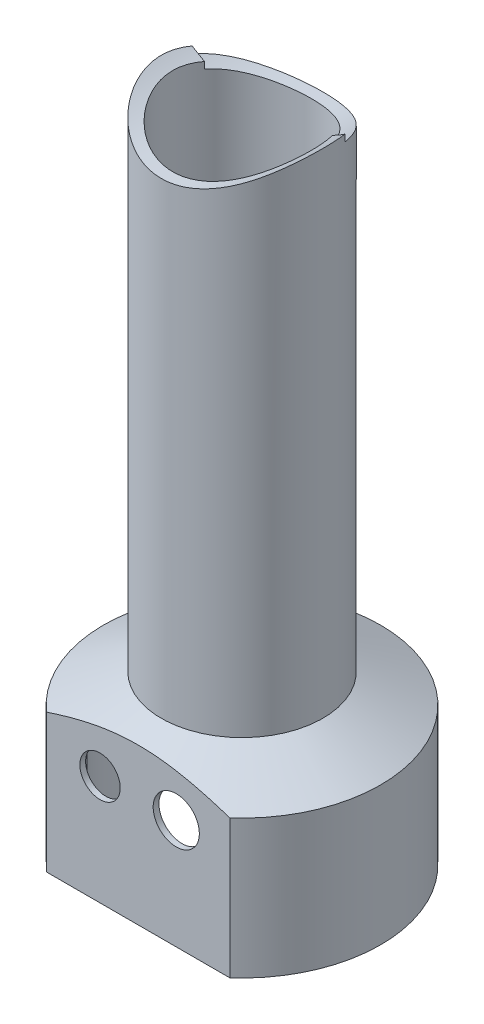
from build123d import *

# Parameters (mm, degrees)
SKETCH1_R               = 14
BOSS_EXTRUDE1_DEPTH     = 105
SKETCH2_R               = 24
CUT_EXTRUDE1_DEPTH      = 110.567330897
SKETCH4_R               = 25
CUT_EXTRUDE2_DEPTH      = 9.4
SKETCH5_R               = 12
CUT_EXTRUDE3_DEPTH      = 123
SKETCH10_R              = 14
SKETCH8_R               = 24
SKETCH12_R              = 24
SKETCH12_R_2            = 19
BOSS_EXTRUDE2_DEPTH     = 24
SKETCH13_R              = 1.6
CUT_EXTRUDE4_DEPTH      = 8
CUT_EXTRUDE6_DEPTH      = 6
BOSS_EXTRUDE7_DEPTH     = 1
CUT_EXTRUDE7_OUTLINE_W  = 25.205591592
CUT_EXTRUDE7_OUTLINE_H  = 24
CUT_EXTRUDE7_DEPTH      = 2.781366517
SKETCH20_R              = 4
SKETCH20_R_2            = 3.5
CUT_EXTRUDE8_DEPTH      = 10
SKETCH22_R              = 1.05
BOSS_EXTRUDE8_DEPTH     = 1
CUT_EXTRUDE9_DEPTH      = 10
CUT_EXTRUDE9_DEPTH_BACK = 5
SKETCH23_R              = 2


with BuildPart() as part:
    # Sketch1 → Boss-Extrude1 (new body)
    with BuildSketch(Plane(origin=(0, 0, 0), x_dir=(1, 0, 0), z_dir=(0, 1, 0))):
        with Locations(Location((0, 0, 0), (0, 0, 270))):
            Circle(SKETCH1_R)
    extrude(amount=BOSS_EXTRUDE1_DEPTH)

    # Sketch2 → Cut-Extrude1 (cut, through all)
    with BuildSketch(Plane(origin=(0, 0, -14), x_dir=(-1, 0, 0), z_dir=(0, 0, -1))):
        with Locations((0, 105)):
            Circle(SKETCH2_R)
    extrude(amount=-CUT_EXTRUDE1_DEPTH, mode=Mode.SUBTRACT)

    # Sketch4 → Cut-Extrude2 (cut)
    with BuildSketch(Plane(origin=(0, 0, -14), x_dir=(-1, 0, 0), z_dir=(0, 0, -1))):
        with Locations((0, 105)):
            Circle(SKETCH4_R)
    extrude(amount=-CUT_EXTRUDE2_DEPTH, mode=Mode.SUBTRACT)

    # Sketch5 → Cut-Extrude3 (cut)
    with BuildSketch(Plane.XZ):
        with Locations(Location((0, 0, 0), (0, 0, 270))):
            Circle(SKETCH5_R)
    extrude(amount=-CUT_EXTRUDE3_DEPTH, mode=Mode.SUBTRACT)

    # Sketch10 → Loft6 section 0
    with BuildSketch(Plane(origin=(0, 0, 0), x_dir=(-1, 0, 0), z_dir=(0, -1, 0))):
        Circle(SKETCH10_R)
    # Sketch8 → Loft6 section 1
    with BuildSketch(Plane(origin=(0, -5, 0), x_dir=(-1, 0, 0), z_dir=(0, -1, 0))):
        Circle(SKETCH8_R)
    loft()

    # Cut-Loft1: read off the stored shape, not the designer's step
    # Cut-Loft1: loft between two sections, ruled curve by curve
    cut_loft1_from = [
        Edge.make_bspline([(-6.918556866, 0, -9.804772863), (12.69098886, 0, -23.641886595), (26.528102592, 0, -4.032340869), (6.918556866, 0, 9.804772863), (-12.69098886, 0, 23.641886595), (-26.528102592, 0, 4.032340869), (-6.918556866, 0, -9.804772863)], [0, 0, 0, 0, 0.5, 0.5, 0.5, 1, 1, 1, 1], 3, [1, 0.333333333, 0.333333333, 1, 0.333333333, 0.333333333, 1]),
    ]
    cut_loft1_to = [
        Edge.make_bspline([(3.659825819, -5, -21.693447743), (47.046721305, -5, -14.373796105), (39.727069667, -5, 29.013099381), (-3.659825819, -5, 21.693447743), (-47.046721305, -5, 14.373796105), (-39.727069667, -5, -29.013099381), (3.659825819, -5, -21.693447743)], [0, 0, 0, 0, 0.5, 0.5, 0.5, 1, 1, 1, 1], 3, [1, 0.333333333, 0.333333333, 1, 0.333333333, 0.333333333, 1]),
    ]
    cut_loft1 = Solid(Shell([*[Face.make_surface_from_curves(cut_loft1_from[k], cut_loft1_to[k]) for k in range(1)], Face(Wire(cut_loft1_from)), Face(Wire(cut_loft1_to))]))
    add(cut_loft1, mode=Mode.SUBTRACT)

    # Sketch12 → Boss-Extrude2 (add)
    with BuildSketch(Plane.XZ.offset(5)):
        Circle(SKETCH12_R)
        Circle(SKETCH12_R_2, mode=Mode.SUBTRACT)
    extrude(amount=BOSS_EXTRUDE2_DEPTH)

    # Sketch13 → Cut-Extrude4 (cut)
    with BuildSketch(Plane.XZ.offset(29)):
        with Locations(Location((-15.202795796, 15.202795796, 0), (0, 0, 270))):
            Circle(SKETCH13_R)
        with Locations(Location((15.202795796, 15.202795796, 0), (0, 0, 270))):
            Circle(SKETCH13_R)
        with Locations(Location((15.202795796, -15.202795796, 0), (0, 0, 270))):
            Circle(SKETCH13_R)
        with Locations(Location((-15.202795796, -15.202795796, 0), (0, 0, 270))):
            Circle(SKETCH13_R)
    extrude(amount=-CUT_EXTRUDE4_DEPTH, mode=Mode.SUBTRACT)

    # Sketch15 → Cut-Extrude6 (cut)
    with BuildSketch(Plane.XY.offset(24)):
        Polygon((-24, -5), (-24, -29), (24, -29), (24, -5), (14, 0), (-14, 0), align=None)
    extrude(amount=-CUT_EXTRUDE6_DEPTH, mode=Mode.SUBTRACT)

    # Sketch17 → Boss-Extrude7 (add)
    with BuildSketch(Plane.XY.offset(18)):
        with BuildLine():
            Line((15.874507866, -29), (15.874507866, -5))
            add(Edge.make_bspline(
                [(-15.874507866, -5), (-14.594943965, -4.576824016), (-12.019648156, -3.781972699), (-9.397994136, -3.134788187), (-7.407221822, -2.727541998), (-6.739521939, -2.6048822), (-5.394539357, -2.390087157), (-4.71546375, -2.297841059), (-2.684830415, -2.075564646), (-1.33504572, -1.999607533), (1.356128498, -2.000395553), (2.697521645, -2.07707476), (5.372653744, -2.369657545), (6.706415867, -2.585139688), (8.702458542, -2.992042885), (9.36832807, -3.141896909), (10.69006115, -3.463557333), (11.346413002, -3.635391758), (13.304203001, -4.178353981), (14.594485661, -4.576672447), (15.874507866, -5)],
                knots=[0, 0, 0, 0, 0.125, 0.25, 0.25, 0.3125, 0.3125, 0.375, 0.375, 0.5, 0.5, 0.625, 0.625, 0.75, 0.75, 0.8125, 0.8125, 0.875, 0.875, 1, 1, 1, 1], degree=3))
            Line((-15.874507866, -5), (-15.874507866, -29))
            Line((-15.874507866, -29), (15.874507866, -29))
        make_face()
    extrude(amount=-BOSS_EXTRUDE7_DEPTH)

    # Cut-Extrude7: read off the stored shape, not the designer's step
    # Cut-Extrude7 outline → Cut-Extrude7 (cut)
    with BuildSketch(Plane(origin=(0, 0, 17), x_dir=(-1, 0, 0), z_dir=(0, 0, -1))):
        with Locations((0, -17)):
            Rectangle(CUT_EXTRUDE7_OUTLINE_W, CUT_EXTRUDE7_OUTLINE_H)
    extrude(amount=CUT_EXTRUDE7_DEPTH, mode=Mode.SUBTRACT)

    # Sketch20 → Cut-Extrude8 (cut)
    with BuildSketch(Plane.XY.offset(18)):
        with Locations((6.602795796, -10)):
            Circle(SKETCH20_R)
        with Locations((-6.602795796, -10)):
            Circle(SKETCH20_R_2)
    extrude(amount=-CUT_EXTRUDE8_DEPTH, mode=Mode.SUBTRACT)

    # Sketch23 → Cut-Extrude9 (cut, two sides: drawn at the far end of the back side and taken through both)
    with BuildSketch(Plane.XY.offset(-12).offset(-CUT_EXTRUDE9_DEPTH_BACK)):
        with Locations(Location((0, 4, 0), (0, 0, 90))):
            Circle(SKETCH23_R)
    extrude(amount=CUT_EXTRUDE9_DEPTH + CUT_EXTRUDE9_DEPTH_BACK, mode=Mode.SUBTRACT)


with BuildPart() as body_2:
    # Sketch22 → Boss-Extrude8 (new body)
    with BuildSketch(Plane.XZ.offset(29)):
        with BuildLine():
            Line((-15.874507866, 18), (15.874507866, 18))
            ThreePointArc((15.874507866, 18), (0, -24), (-15.874507866, 18))
        make_face()
        with Locations(Location((-15.202795796, 15.202795796, 0), (0, 0, 270))):
            Circle(SKETCH22_R, mode=Mode.SUBTRACT)
        with Locations(Location((15.202795796, 15.202795796, 0), (0, 0, 270))):
            Circle(SKETCH22_R, mode=Mode.SUBTRACT)
        with Locations(Location((15.202795796, -15.202795796, 0), (0, 0, 270))):
            Circle(SKETCH22_R, mode=Mode.SUBTRACT)
        with Locations(Location((-15.202795796, -15.202795796, 0), (0, 0, 270))):
            Circle(SKETCH22_R, mode=Mode.SUBTRACT)
    extrude(amount=BOSS_EXTRUDE8_DEPTH)


solid = part.part
